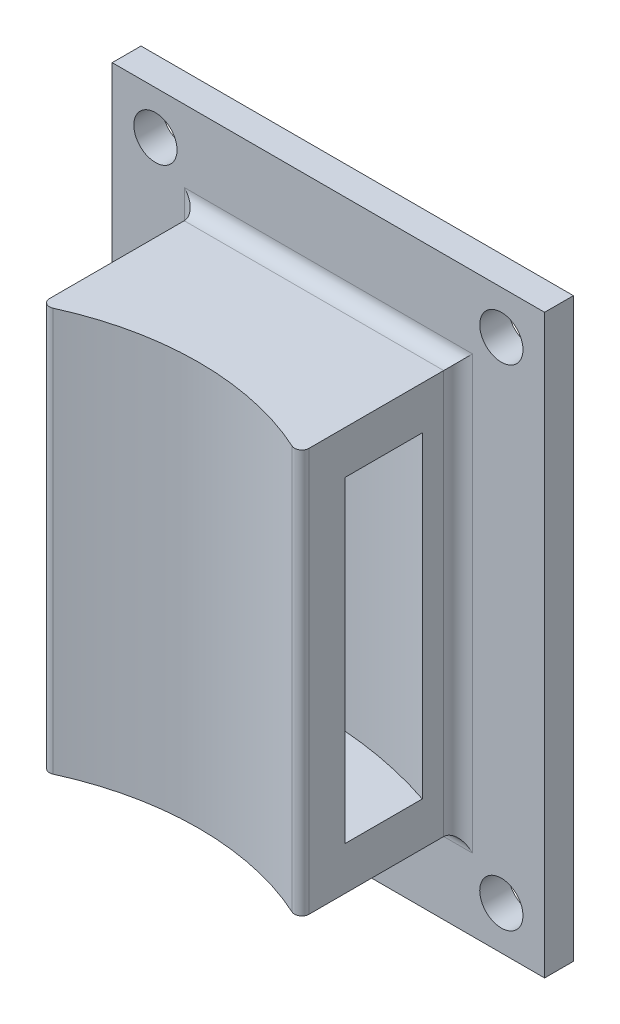
from build123d import *

# Parameters (mm, degrees)
EXTRUDE_1_DEPTH     = 11
EXTRUDE_1_2_DEPTH   = 11
EXTRUDE_2_DEPTH     = 3
SKETCH_5_W          = 30
SKETCH_5_H          = 40
SKETCH_5_W_2        = 18
SKETCH_5_H_2        = 28
EXTRUDE_3_DEPTH     = 2
SKETCH_6_R          = 1.5
CUT_EXTRUDE_1_DEPTH = 28.369451515
FILLET_1_R          = 1
FILLET_2_R          = 0.5


with BuildPart() as part:
    # 草图1 → 凸台-拉伸1 (new, symmetric)
    with BuildSketch(Plane(origin=(0, 0, 0), x_dir=(1, 0, 0), z_dir=(0, 1, 0))):
        with BuildLine():
            Line((-9, 31), (-9, 26.514147167))
            ThreePointArc((-9, 26.514147167), (0, 28), (9, 26.514147167))
            Line((9, 26.514147167), (9, 31))
            Line((9, 31), (-9, 31))
        make_face()
    extrude(amount=EXTRUDE_1_DEPTH, both=True)



with BuildPart() as body_2:
    # 草图1 → Extrude 1 2 (new, symmetric)
    with BuildSketch(Plane(origin=(0, 0, 0), x_dir=(1, 0, 0), z_dir=(0, 1, 0))):
        with BuildLine():
            Line((-9, 21.166010489), (-9, 17.860571099))
            ThreePointArc((-9, 17.860571099), (0, 20), (9, 17.860571099))
            Line((9, 17.860571099), (9, 21.166010489))
            ThreePointArc((9, 21.166010489), (0, 23), (-9, 21.166010489))
        make_face()
    extrude(amount=EXTRUDE_1_2_DEPTH, both=True)


with BuildPart() as part_1:
    add(part.part)

    add(body_2.part)  # 凸台-拉伸2 merges body 2
    # 草图2 → 凸台-拉伸2 (add)
    with BuildSketch(Plane(origin=(0, 11, 0), x_dir=(1, 0, 0), z_dir=(0, 1, 0))):
        with BuildLine():
            Line((-9, 31), (-9, 17.860571099))
            ThreePointArc((-9, 17.860571099), (0, 20), (9, 17.860571099))
            Line((9, 17.860571099), (9, 31))
            Line((9, 31), (-9, 31))
        make_face()
    extrude_2 = extrude(amount=EXTRUDE_2_DEPTH)

    # 镜向1: 凸台-拉伸2 across plane
    add(extrude_2.mirror(Plane.ZX))

    # 草图5 → 凸台-拉伸3 (add)
    with BuildSketch(Plane(origin=(0, 0, -31), x_dir=(-1, 0, 0), z_dir=(0, 0, -1))):
        Rectangle(SKETCH_5_W, SKETCH_5_H)
        Rectangle(SKETCH_5_W_2, SKETCH_5_H_2, mode=Mode.SUBTRACT)
    extrude(amount=-EXTRUDE_3_DEPTH)

    # 草图6 → 切除-拉伸1 (cut, through all)
    with BuildSketch(Plane.XY.offset(-29)):
        with Locations((12, 17)):
            Circle(SKETCH_6_R)
        with Locations((-12, 17)):
            Circle(SKETCH_6_R)
        with Locations((12, -17)):
            Circle(SKETCH_6_R)
        with Locations((-12, -17)):
            Circle(SKETCH_6_R)
    extrude(amount=-CUT_EXTRUDE_1_DEPTH, mode=Mode.SUBTRACT)

    # 圆角1
    fillet_1_edges = [part_1.edges().sort_by_distance(p)[0] for p in [
        (9, 0, -29),
        (0, 14, -29),
        (-9, 0, -29),
        (0, -14, -29),
    ]]
    fillet(fillet_1_edges, radius=FILLET_1_R)

    # 圆角2
    fillet_2_edges = [part_1.edges().sort_by_distance(p)[0] for p in [
        (9, 0, -17.860571099),
        (-9, 0, -17.860571099),
    ]]
    fillet(fillet_2_edges, radius=FILLET_2_R)


solid = part_1.part
